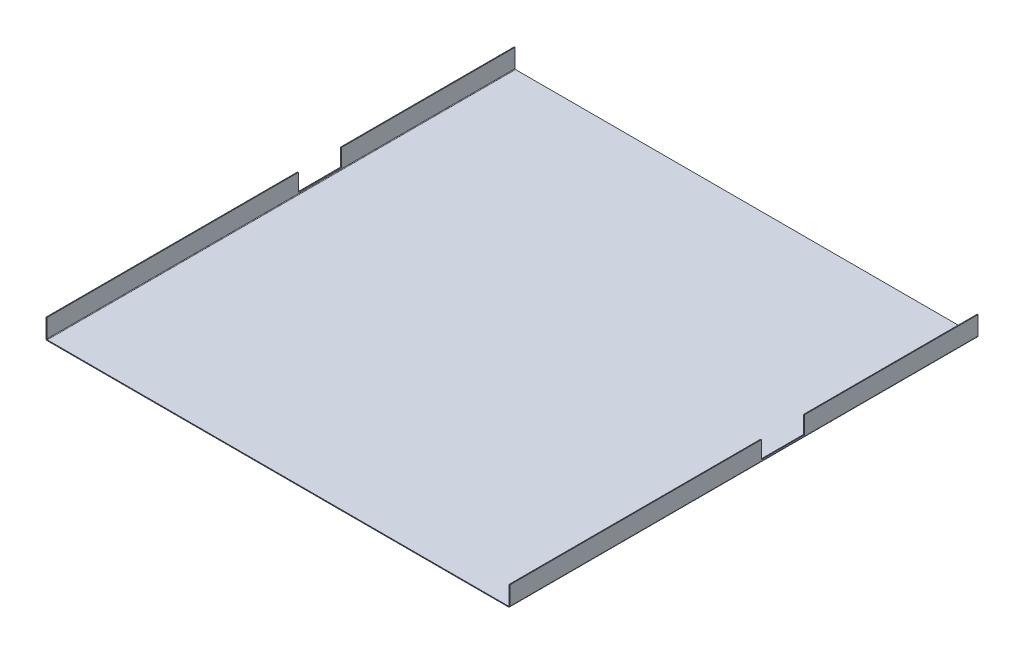
from build123d import *

# Parameters (mm, degrees)
SKETCH2_W               = 590.8
SKETCH2_H               = 600
BASE_FLANGE1_DEPTH      = 1.016
EDGE_FLANGE1_DEPTH      = 600
EDGE_FLANGE1_BEND_DEPTH = 600
CUT_EXTRUDE1_DEPTH      = 845.862743377
CUT_EXTRUDE1_DEPTH_BACK = 845.862743377
SKETCH31_W              = 55.3
SKETCH31_H              = 22.226


# Sheet-metal steps are written as plain solids
with BuildPart() as part:
    # Sketch2 → Base-Flange1 (new body)
    with BuildSketch(Plane(origin=(0, 0, 0), x_dir=(1, 0, 0), z_dir=(0, 1, 0))):
        with Locations((295.4, 300)):
            Rectangle(SKETCH2_W, SKETCH2_H)
    extrude(amount=-BASE_FLANGE1_DEPTH)

    # Edge-Flange1 section (across the edge) → Edge-Flange1 (add)
    with BuildSketch(Plane(origin=(-0.7366, 0, -600), x_dir=(1, 0, 0), z_dir=(0, 0, 1))):
        with BuildLine():
            Line((-1.016, 0.7366), (-1.016, 24.38))
            Line((-1.016, 24.38), (0, 24.38))
            Line((0, 24.38), (0, 0.7366))
            ThreePointArc((0, 0.7366), (0.215745145, 0.215745145), (0.7366, 0))
            Line((0.7366, 0), (0.7366, -1.016))
            ThreePointArc((0.7366, -1.016), (-0.502675345, -0.502675345), (-1.016, 0.7366))
        make_face()
    extrude(amount=EDGE_FLANGE1_DEPTH)

    # Edge-Flange1 section 2 (across the edge) → Edge-Flange1 bend (add)
    with BuildSketch(Plane(origin=(591.5366, 0, 0), x_dir=(-1, 0, 0), z_dir=(0, 0, -1))):
        with BuildLine():
            Line((-1.016, 0.7366), (-1.016, 24.38))
            Line((-1.016, 24.38), (0, 24.38))
            Line((0, 24.38), (0, 0.7366))
            ThreePointArc((0, 0.7366), (0.215745145, 0.215745145), (0.7366, 0))
            Line((0.7366, 0), (0.7366, -1.016))
            ThreePointArc((0.7366, -1.016), (-0.502675345, -0.502675345), (-1.016, 0.7366))
        make_face()
    extrude(amount=EDGE_FLANGE1_BEND_DEPTH)

    # Sketch31 → Cut-Extrude1 (cut, two sides: drawn at the far end of the back side and taken through both)
    with BuildSketch(Plane.ZY.offset(1.7526).offset(-CUT_EXTRUDE1_DEPTH_BACK)):
        with Locations((-350, 13.267)):
            Rectangle(SKETCH31_W, SKETCH31_H)
    extrude(amount=CUT_EXTRUDE1_DEPTH + CUT_EXTRUDE1_DEPTH_BACK, mode=Mode.SUBTRACT)


solid = part.part
